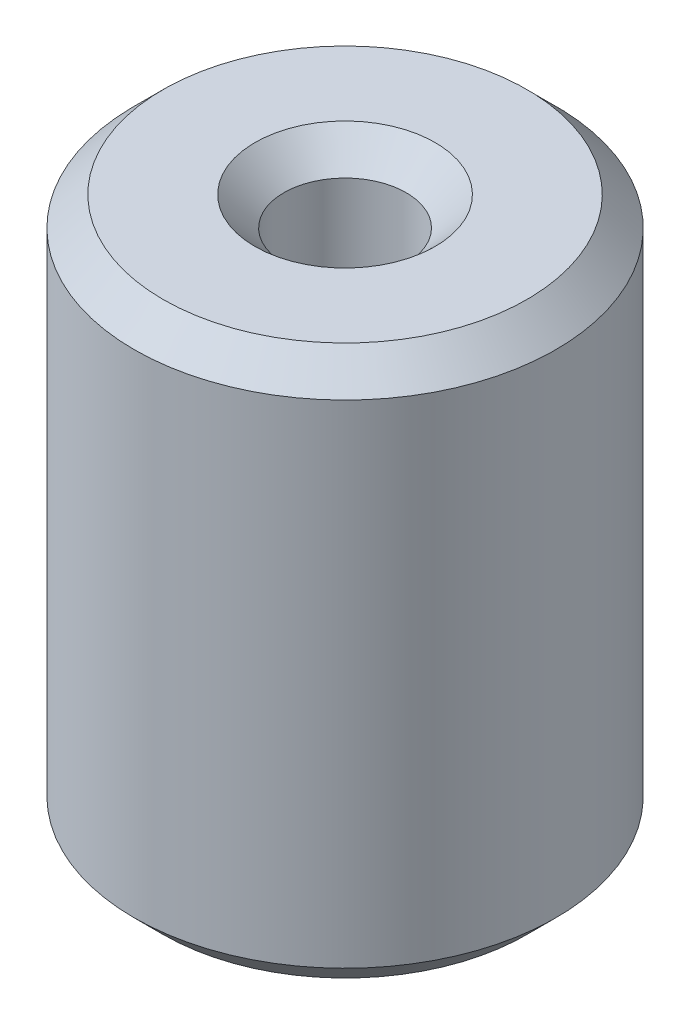
from build123d import *

# Parameters (mm, degrees)
SKETCH1_R           = 5
BOSS_EXTRUDE1_DEPTH = 13.042398683
SKETCH2_R           = 1.45006041
CUT_EXTRUDE1_DEPTH  = 15.835907907
CHAMFER1_SIZE       = 0.686464397


with BuildPart() as part:
    # Sketch1 → Boss-Extrude1 (new body)
    with BuildSketch(Plane(origin=(0, 0, 0), x_dir=(1, 0, 0), z_dir=(0, 1, 0))):
        Circle(SKETCH1_R)
    extrude(amount=BOSS_EXTRUDE1_DEPTH)

    # Sketch2 → Cut-Extrude1 (cut, through all)
    with BuildSketch(Plane(origin=(0, 0, 0), x_dir=(1, 0, 0), z_dir=(0, 1, 0))):
        Circle(SKETCH2_R)
    extrude(amount=CUT_EXTRUDE1_DEPTH, mode=Mode.SUBTRACT)

    # Chamfer1
    chamfer1_edges = [part.edges().sort_by_distance(p)[0] for p in [
        (-1.45006041, 13.042398683, 0),
        (-1.45006041, 0, 0),
        (-5, 0, 0),
        (-5, 13.042398683, 0),
    ]]
    chamfer(chamfer1_edges, length=CHAMFER1_SIZE)


solid = part.part
